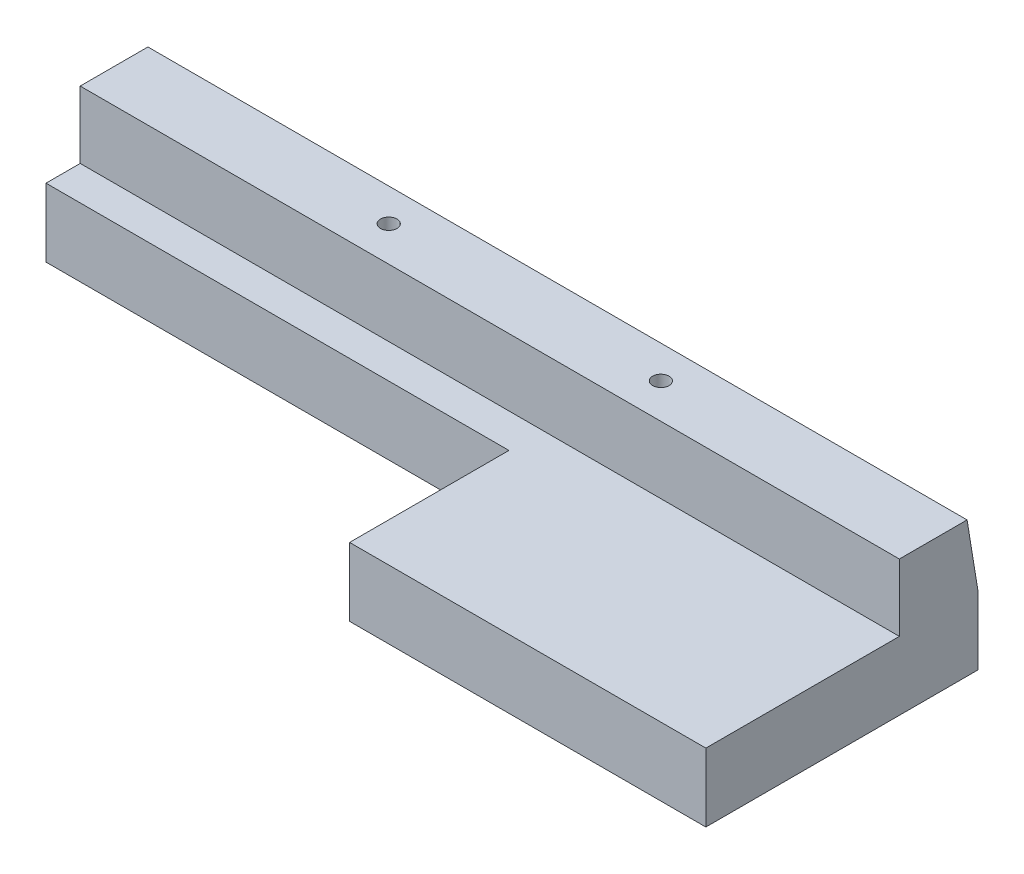
from build123d import *

# Parameters (mm, degrees)
SZKIC1_W                                             = 119.8
SZKIC1_H                                             = 10
DODANIE_WYCI_GNI_CIE2_DEPTH                          = 38.3
SZKIC21_W                                            = 119.8
SZKIC21_H                                            = 10
DODANIE_WYCI_GNI_CIE3_DEPTH                          = 9.8
POG_BIENIE_WALCOWE_POD_M2_WKR_T_DO_CZ_CI_D           = 2.4
POG_BIENIE_WALCOWE_POD_M2_WKR_T_DO_CZ_CI_CBORE_D     = 5
POG_BIENIE_WALCOWE_POD_M2_WKR_T_DO_CZ_CI_CBORE_DEPTH = 1.6
SZKIC28_R                                            = 11.1
WYTNIJ_WYCI_GNI_CIE1_DEPTH                           = 7.2
WYTNIJ_WYCI_GNI_CIE4_DEPTH                           = 124.8
DODANIE_WYCI_GNI_CIE5_DEPTH                          = 119.8
SZKIC34_W                                            = 119.8
SZKIC34_H                                            = 10
DODANIE_WYCI_GNI_CIE6_DEPTH                          = 1.5
SZKIC38_W                                            = 67.7
SZKIC38_H                                            = 10
WYTNIJ_WYCI_GNI_CIE5_DEPTH                           = 23.3


with BuildPart() as part:
    # Szkic1 → Dodanie-wyciągnięcie2 (new body)
    with BuildSketch(Plane.XY):
        with Locations((1.59336777, 27.024849398)):
            Rectangle(SZKIC1_W, SZKIC1_H)
    extrude(amount=DODANIE_WYCI_GNI_CIE2_DEPTH)

    # Szkic21 → Dodanie-wyciągnięcie3 (add)
    with BuildSketch(Plane(origin=(0, 32.024849398, 0), x_dir=(1, 0, 0), z_dir=(0, 1, 0))):
        with Locations((1.59336777, -5)):
            Rectangle(SZKIC21_W, SZKIC21_H)
    extrude(amount=DODANIE_WYCI_GNI_CIE3_DEPTH)

    # Pogłębienie walcowe pod M2 wkręt do części metalowych z łbem stożkowym ściętym2 (through all)
    with Locations(Plane(origin=(0, 22.024849398, 0), x_dir=(-1, 0, 0), z_dir=(0, -1, 0))):
        with Locations((-21.49336777, -4.88), (18.30663223, -4.88)):
            CounterBoreHole(POG_BIENIE_WALCOWE_POD_M2_WKR_T_DO_CZ_CI_D / 2, POG_BIENIE_WALCOWE_POD_M2_WKR_T_DO_CZ_CI_CBORE_D / 2, POG_BIENIE_WALCOWE_POD_M2_WKR_T_DO_CZ_CI_CBORE_DEPTH)

    # Szkic28 → Wytnij-wyciągnięcie1 (cut)
    with BuildSketch(Plane.XZ.offset(-22.024849398)):
        with Locations((36.49336777, 23.3)):
            Circle(SZKIC28_R)
    extrude(amount=-WYTNIJ_WYCI_GNI_CIE1_DEPTH, mode=Mode.SUBTRACT)

    # Szkic31 → Wytnij-wyciągnięcie4 (cut)
    with BuildSketch(Plane(origin=(61.49336777, 0, 0), x_dir=(0, 0, -1), z_dir=(1, 0, 0))):
        Polygon((0, 41.824849398), (-0.096491228, 41.824849398), (0, 41.232541705), align=None)
    extrude(amount=-WYTNIJ_WYCI_GNI_CIE4_DEPTH, mode=Mode.SUBTRACT)

    # Szkic31<5> → Dodanie-wyciągnięcie5 (add)
    with BuildSketch(Plane(origin=(61.49336777, 0, 0), x_dir=(0, 0, -1), z_dir=(1, 0, 0))):
        Polygon((0, 41.232541705), (0, 32.024849398), (1.5, 32.024849398), (0.275236278, 39.543014399), align=None)
    extrude(amount=-DODANIE_WYCI_GNI_CIE5_DEPTH)

    # Szkic34 → Dodanie-wyciągnięcie6 (add)
    with BuildSketch(Plane(origin=(0, 0, 0), x_dir=(-1, 0, 0), z_dir=(0, 0, -1))):
        with Locations((-1.59336777, 27.024849398)):
            Rectangle(SZKIC34_W, SZKIC34_H)
    extrude(amount=DODANIE_WYCI_GNI_CIE6_DEPTH)


with BuildPart() as body_2:
    # Lustro2: mirrored copy
    add(part.part.mirror(Plane(origin=(-58.30663223, 22.024849398, 38.3), x_dir=(0, 0, 1), z_dir=(0, 1, 0))))


with BuildPart() as body_2_1:
    # Obiekt-Przenieś/Kopiuj1: moved
    add(body_2.part.moved(Location((0, -36.76628261, 0))))

    # Szkic38 → Wytnij-wyciągnięcie5 (cut)
    with BuildSketch(Plane.XY.offset(38.3)):
        with Locations((-24.45663223, -19.741433212)):
            Rectangle(SZKIC38_W, SZKIC38_H)
    extrude(amount=-WYTNIJ_WYCI_GNI_CIE5_DEPTH, mode=Mode.SUBTRACT)


with BuildPart() as body_2_2:
    # Lustro3: mirrored copy
    add(body_2_1.part.mirror(Plane(origin=(11.571570583, -14.741433212, 13.198156942), x_dir=(0, 0, 1), z_dir=(0, 1, 0))))


with BuildPart() as body_2_2_1:
    # Obiekt-Przenieś/Kopiuj2: moved
    add(body_2_2.part.moved(Location((0, 52.156291161, 0))))


solid = body_2_2_1.part
